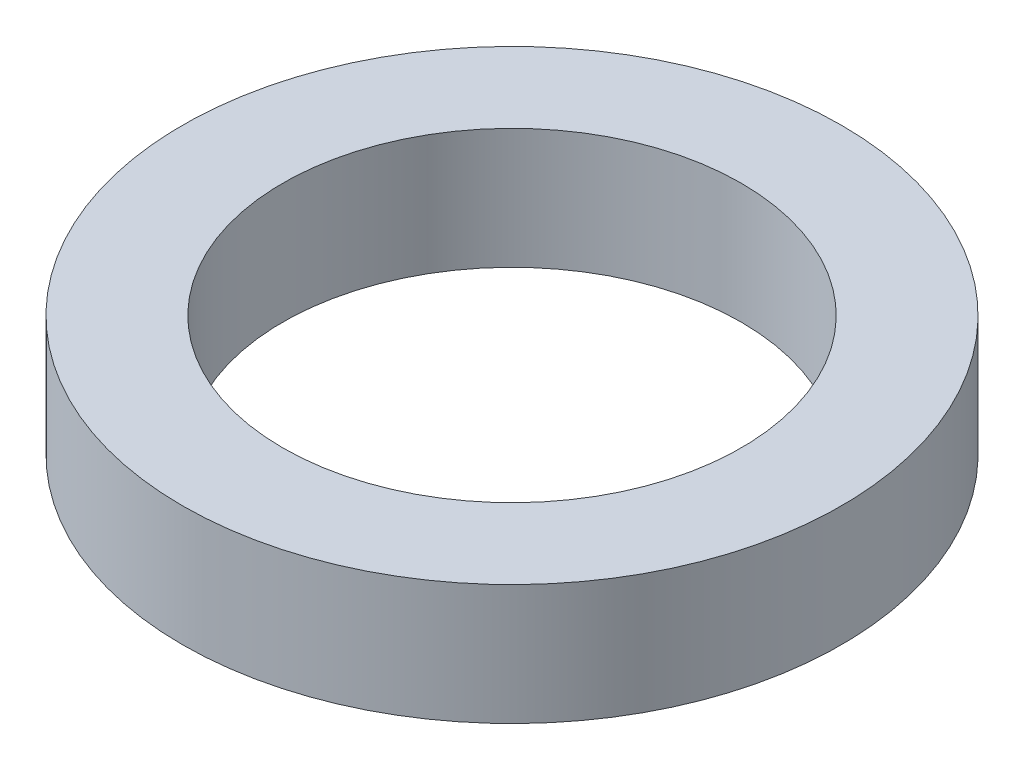
from build123d import *

# Parameters (mm, degrees)
SKETCH1_R           = 57.5
BOSS_EXTRUDE1_DEPTH = 21
SKETCH2_R           = 40
CUT_EXTRUDE1_DEPTH  = 84.985117729


with BuildPart() as part:
    # Sketch1 → Boss-Extrude1 (new body)
    with BuildSketch(Plane(origin=(0, 0, 0), x_dir=(1, 0, 0), z_dir=(0, 1, 0))):
        Circle(SKETCH1_R)
    extrude(amount=BOSS_EXTRUDE1_DEPTH)

    # Sketch2 → Cut-Extrude1 (cut, through all)
    with BuildSketch(Plane(origin=(0, 0, 0), x_dir=(1, 0, 0), z_dir=(0, 1, 0))):
        Circle(SKETCH2_R)
    extrude(amount=CUT_EXTRUDE1_DEPTH, mode=Mode.SUBTRACT)


solid = part.part
